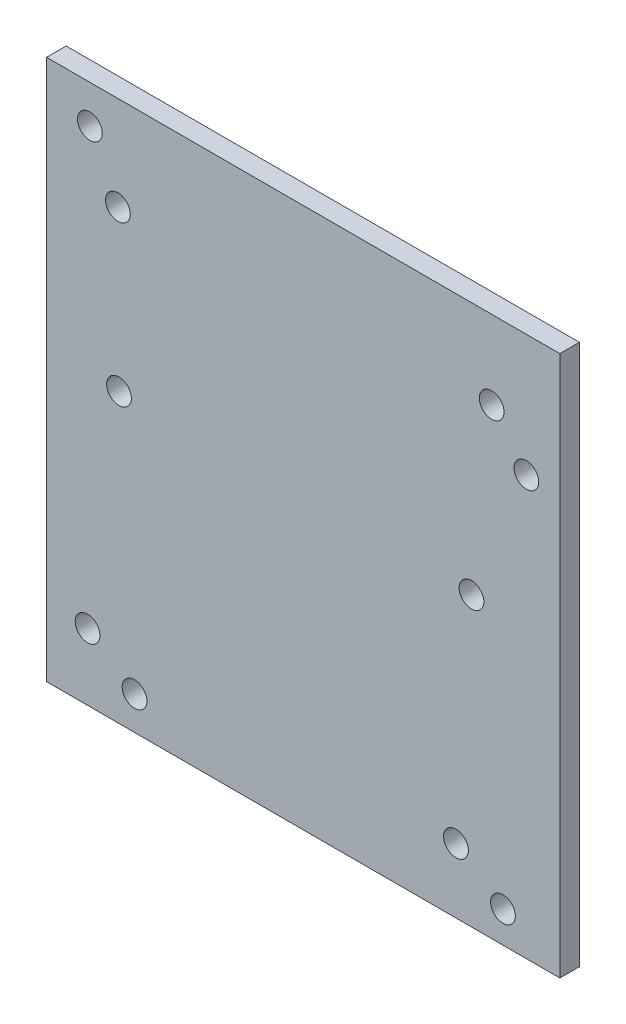
from build123d import *

# Parameters (mm, degrees)
SKETCH1_W           = 166.44628819
SKETCH1_H           = 175.350054565
SKETCH1_R           = 4.0127
SKETCH1_R_2         = 4.0132
BOSS_EXTRUDE1_DEPTH = 6.35


with BuildPart() as part:
    # Sketch1 → Boss-Extrude1 (new body)
    with BuildSketch(Plane.XY):
        with Locations((-612.934360792, 295.578292869)):
            Rectangle(SKETCH1_W, SKETCH1_H)
        with Locations((-667.625800723, 218.698265586)):
            Circle(SKETCH1_R, mode=Mode.SUBTRACT)
        with Locations((-682.865800723, 229.493265586)):
            Circle(SKETCH1_R, mode=Mode.SUBTRACT)
        with Locations((-682.121778024, 370.932816424)):
            Circle(SKETCH1_R, mode=Mode.SUBTRACT)
        with Locations((-673.025414388, 352.751458015)):
            Circle(SKETCH1_R, mode=Mode.SUBTRACT)
        with Locations((-551.816021726, 357.766762234)):
            Circle(SKETCH1_R, mode=Mode.SUBTRACT)
        with Locations((-540.572963718, 343.760561942)):
            Circle(SKETCH1_R, mode=Mode.SUBTRACT)
        with Locations((-548.15692674, 218.063265586)):
            Circle(SKETCH1_R, mode=Mode.SUBTRACT)
        with Locations((-563.39692674, 228.858265586)):
            Circle(SKETCH1_R, mode=Mode.SUBTRACT)
        with Locations((-558.361573731, 301.206157994)):
            Circle(SKETCH1_R_2, mode=Mode.SUBTRACT)
        with Locations((-672.661153731, 301.206157994)):
            Circle(SKETCH1_R_2, mode=Mode.SUBTRACT)
    extrude(amount=BOSS_EXTRUDE1_DEPTH)


solid = part.part
